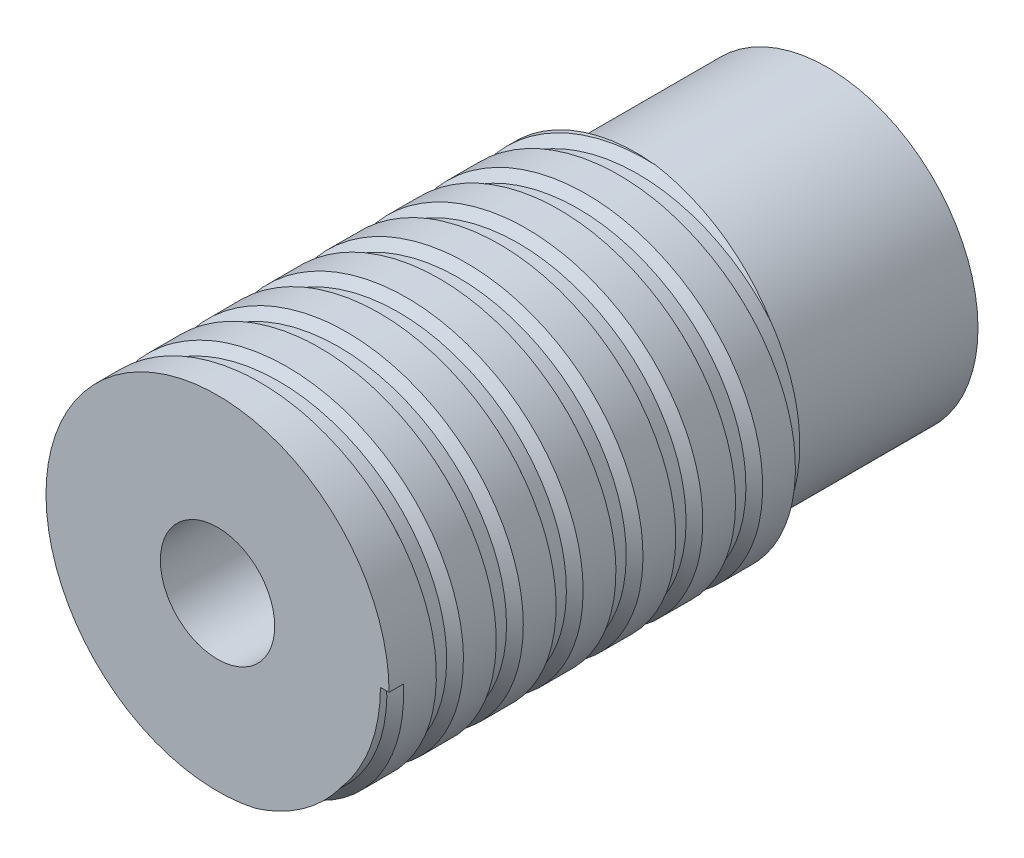
from build123d import *

# Parameters (mm, degrees)
SKETCH_1_R          = 7.9
EXTRUDE_1_DEPTH     = 10
SKETCH_2_R          = 9
EXTRUDE_2_DEPTH     = 22
SWEEP_2_PITCH       = 3.14
CUT_EXTRUDE_1_REACH = 36.438
SKETCH_9_R          = 3


with BuildPart() as part:
    # 草图1 → 凸台-拉伸1 (new body)
    with BuildSketch(Plane.XY):
        Circle(SKETCH_1_R)
    extrude(amount=EXTRUDE_1_DEPTH)

    # 草图2 → 凸台-拉伸2 (add)
    with BuildSketch(Plane.XY.offset(10)):
        Circle(SKETCH_2_R)
    extrude(amount=EXTRUDE_2_DEPTH)

    # 切除-扫描2: arcs per turn and ends read off the stored shape
    # 切除-扫描2: the profile of 草图8 profile screwed along a right-hand helix through 8 turns, 10 arcs to a turn; built about Z, then put on its axis
    sweep_2_z = Axis((0, 0, 0), (0, 0, 1))
    sweep_2_corners = [(8.547724204, 0, -2.765745293), (8.547724204, 0, -3.441338122), (9.0003, 0, -3.868834611), (9.0003, 0, -2.447608371)]
    with BuildLine(mode=Mode.PRIVATE) as sweep_2_profile:
        Line(sweep_2_corners[0], sweep_2_corners[1])
        Line(sweep_2_corners[1], sweep_2_corners[2])
        Line(sweep_2_corners[2], sweep_2_corners[3])
        Line(sweep_2_corners[3], sweep_2_corners[0])
    sweep_2_cap = Face(sweep_2_profile.wire())
    sweep_2_turn_angles = [0, 18, 36, 54, 72, 90, 108, 126, 144, 162, 180, 198, 216, 234, 252, 270, 288, 306, 324, 342, 360]
    sweep_2_turn_weights = [1, 0.9510565162951535, 1, 0.9510565162951535, 1, 0.9510565162951535, 1, 0.9510565162951535, 1, 0.9510565162951535, 1, 0.9510565162951535, 1, 0.9510565162951535, 1, 0.9510565162951535, 1, 0.9510565162951535, 1, 0.9510565162951535, 1]
    sweep_2_turn_rails = [Edge.make_bspline([Vector(p[0], p[1], 0).rotate(sweep_2_z, sweep_2_turn_angles[k]) / sweep_2_turn_weights[k] + Vector(0, 0, p[2] + SWEEP_2_PITCH * sweep_2_turn_angles[k] / 360) for k in range(21)], [0, 0, 0, 1, 1, 2, 2, 3, 3, 4, 4, 5, 5, 6, 6, 7, 7, 8, 8, 9, 9, 10, 10, 10], 2, sweep_2_turn_weights) for p in sweep_2_corners]
    sweep_2_turn_sides = [Face.make_surface_from_curves(sweep_2_turn_rails[p[0]], sweep_2_turn_rails[p[1]]) for p in [(0, 1), (1, 2), (2, 3), (3, 0)]]
    sweep_2 = Plane(origin=(0, 0, 10), x_dir=(1, 0, 0), z_dir=(0, 0, 1)) * Solid(Shell([*[p.moved(Location((0, 0, SWEEP_2_PITCH * i))) for i in range(8) for p in sweep_2_turn_sides], sweep_2_cap, sweep_2_cap.rotate(sweep_2_z, 2880).moved(Location((0, 0, SWEEP_2_PITCH * 2880 / 360)))]))
    add(sweep_2, mode=Mode.SUBTRACT)

    # 草图9 → 切除-拉伸1 (cut, up to next)
    with BuildSketch(Plane(origin=(0, 0, 0), x_dir=(-1, 0, 0), z_dir=(0, 0, -1)), mode=Mode.PRIVATE) as cut_extrude_1_sk1:
        Circle(SKETCH_9_R)
    cut_extrude_1_tool1 = extrude(cut_extrude_1_sk1.sketch, amount=-CUT_EXTRUDE_1_REACH, mode=Mode.PRIVATE) & part.part
    add(cut_extrude_1_tool1.solids().sort_by_distance((0, 0, 0))[0], mode=Mode.SUBTRACT)


solid = part.part
